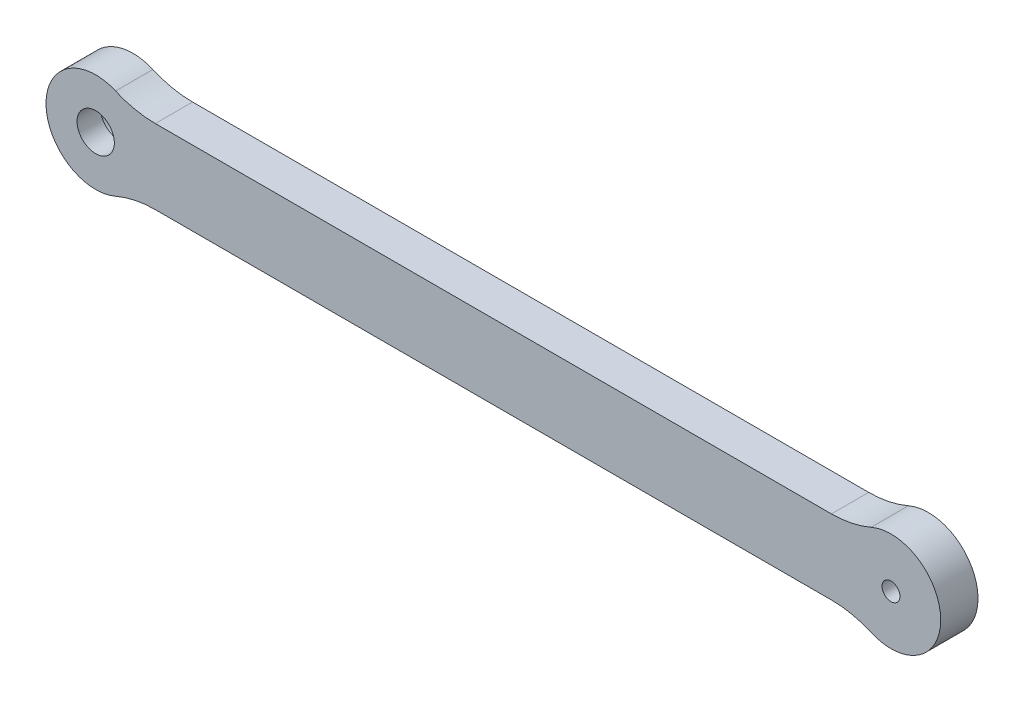
from build123d import *

# Parameters (mm, degrees)
BOSS_EXTRUDE1_DEPTH = 9.525
SKETCH2_R           = 5.9944
CUT_EXTRUDE1_DEPTH  = 3.556
SKETCH3_R           = 4.7625
CUT_EXTRUDE2_DEPTH  = 217.355561428
SKETCH4_R           = 2.286
CUT_EXTRUDE3_DEPTH  = 217.482852958


with BuildPart() as part:
    # Sketch1 → Boss-Extrude1 (new body)
    with BuildSketch(Plane.XY):
        with BuildLine():
            Line((-187.973234913, 9.525), (-15.226765087, 9.525))
            ThreePointArc((-15.226765087, 9.525), (-10.042011798, 10.059796737), (-5.075588362, 11.641666667))
            ThreePointArc((-5.075588362, 11.641666667), (12.7, 0), (-5.075588362, -11.641666667))
            ThreePointArc((-5.075588362, -11.641666667), (-10.042011798, -10.059796737), (-15.226765087, -9.525))
            Line((-15.226765087, -9.525), (-187.973234913, -9.525))
            ThreePointArc((-187.973234913, -9.525), (-193.157988202, -10.059796737), (-198.124411638, -11.641666667))
            ThreePointArc((-198.124411638, -11.641666667), (-215.9, 0), (-198.124411638, 11.641666667))
            ThreePointArc((-198.124411638, 11.641666667), (-193.157988202, 10.059796737), (-187.973234913, 9.525))
        make_face()
    extrude(amount=BOSS_EXTRUDE1_DEPTH)

    # Sketch2 → Cut-Extrude1 (cut)
    with BuildSketch(Plane.XY):
        with Locations((-203.2, 0)):
            Circle(SKETCH2_R)
    extrude(amount=CUT_EXTRUDE1_DEPTH, mode=Mode.SUBTRACT)

    # Sketch3 → Cut-Extrude2 (cut, through all)
    with BuildSketch(Plane(origin=(0, 0, 3.556), x_dir=(-1, 0, 0), z_dir=(0, 0, -1))):
        with Locations((203.2, 0)):
            Circle(SKETCH3_R)
    extrude(amount=-CUT_EXTRUDE2_DEPTH, mode=Mode.SUBTRACT)

    # Sketch4 → Cut-Extrude3 (cut, through all)
    with BuildSketch(Plane.XY.offset(9.525)):
        Circle(SKETCH4_R)
    extrude(amount=-CUT_EXTRUDE3_DEPTH, mode=Mode.SUBTRACT)


solid = part.part
